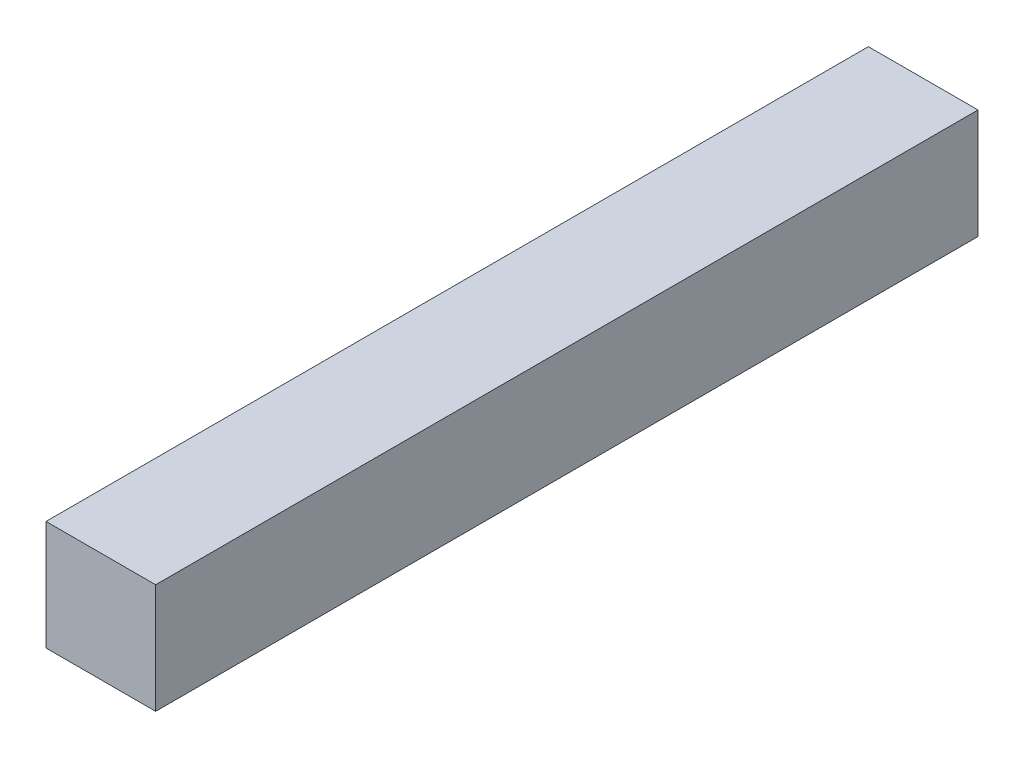
from build123d import *

# Parameters (mm, degrees)
SKETCH1_W           = 50
SKETCH1_H           = 50
BOSS_EXTRUDE1_DEPTH = 375


with BuildPart() as part:
    # Sketch1 → Boss-Extrude1 (new body)
    with BuildSketch(Plane.XY):
        Rectangle(SKETCH1_W, SKETCH1_H)
    extrude(amount=BOSS_EXTRUDE1_DEPTH)


solid = part.part
